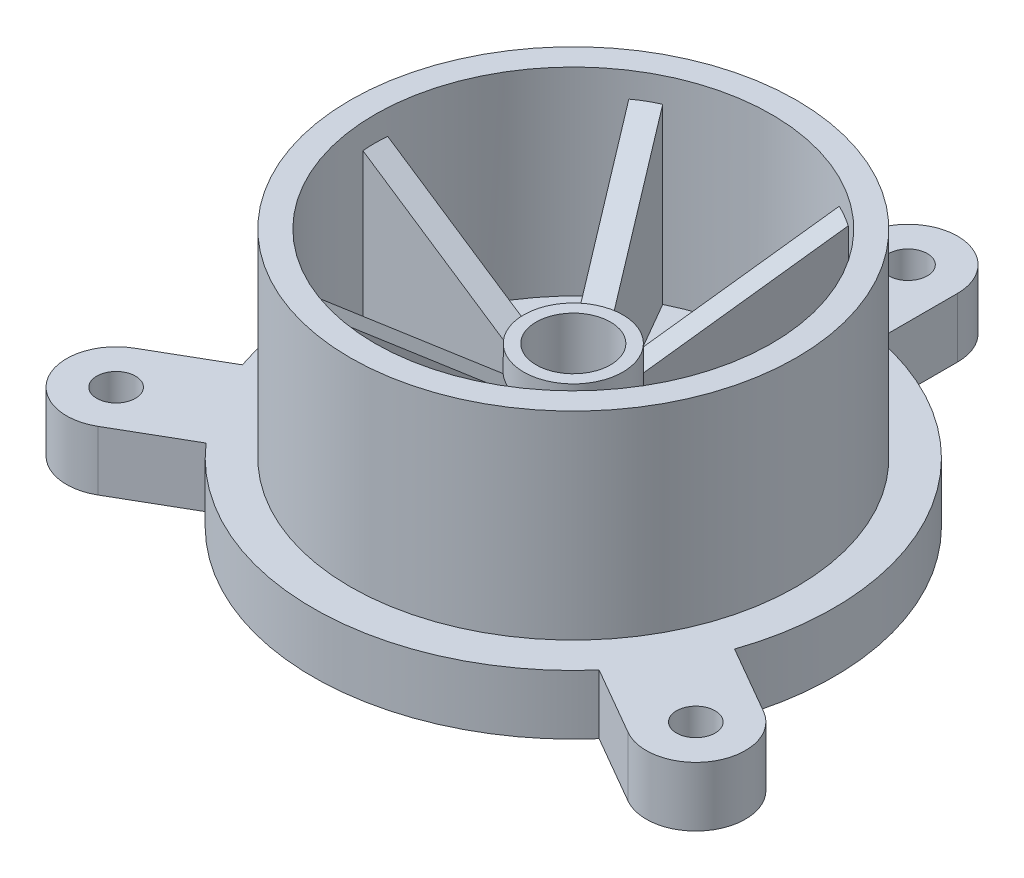
from build123d import *

# Parameters (mm, degrees)
SKETCH1_R           = 3.9
BOSS_EXTRUDE1_DEPTH = 12
SKETCH2_R           = 7.5
CUT_EXTRUDE1_DEPTH  = 12
BOSS_EXTRUDE2_START = 20
SKETCH4_R           = 10
SKETCH4_R_2         = 7.5
BOSS_EXTRUDE2_DEPTH = 20
SKETCH5_R           = 45
SKETCH5_R_2         = 40
BOSS_EXTRUDE3_DEPTH = 40
RIB1_REACH          = 117.744
SKETCH6_WALL_W      = 269.542633736
SKETCH6_WALL_H      = 5
CIRPATTERN1_COUNT   = 6


with BuildPart() as part:
    # Sketch1 → Boss-Extrude1 (new body)
    with BuildSketch(Plane(origin=(0, 0, 0), x_dir=(1, 0, 0), z_dir=(0, 1, 0))):
        with BuildLine():
            ThreePointArc((10, 67.5), (0, 77.5), (-10, 67.5))
            Line((-10, 67.5), (-10, 51.53882032))
            ThreePointArc((-10, 51.53882032), (-45.466333699, 26.25), (-49.633927678, -17.109156122))
            Line((-49.633927678, -17.109156122), (-63.456714755, -25.089745962))
            ThreePointArc((-63.456714755, -25.089745962), (-67.116968793, -38.75), (-53.456714755, -42.410254038))
            Line((-53.456714755, -42.410254038), (-39.633927678, -34.429664198))
            ThreePointArc((-39.633927678, -34.429664198), (0, -52.5), (39.633927678, -34.429664198))
            Line((39.633927678, -34.429664198), (53.456714755, -42.410254038))
            ThreePointArc((53.456714755, -42.410254038), (67.116968793, -38.75), (63.456714755, -25.089745962))
            Line((63.456714755, -25.089745962), (49.633927678, -17.109156122))
            ThreePointArc((49.633927678, -17.109156122), (45.466333699, 26.25), (10, 51.53882032))
            Line((10, 51.53882032), (10, 67.5))
        make_face()
        with Locations((-58.456714755, -33.75)):
            Circle(SKETCH1_R, mode=Mode.SUBTRACT)
        with Locations((58.456714755, -33.75)):
            Circle(SKETCH1_R, mode=Mode.SUBTRACT)
        with Locations((0, 67.5)):
            Circle(SKETCH1_R, mode=Mode.SUBTRACT)
    extrude(amount=BOSS_EXTRUDE1_DEPTH)

    # Sketch2 → Cut-Extrude1 (cut)
    with BuildSketch(Plane(origin=(0, 12, 0), x_dir=(1, 0, 0), z_dir=(0, 1, 0))):
        Circle(SKETCH2_R)
    extrude(amount=-CUT_EXTRUDE1_DEPTH, mode=Mode.SUBTRACT)

    # Sketch4 → Boss-Extrude2 (add)
    with BuildSketch(Plane(origin=(0, 12, 0), x_dir=(1, 0, 0), z_dir=(0, 1, 0)).offset(BOSS_EXTRUDE2_START)):
        Circle(SKETCH4_R)
        Circle(SKETCH4_R_2, mode=Mode.SUBTRACT)
    extrude(amount=-BOSS_EXTRUDE2_DEPTH)

    # Sketch5 → Boss-Extrude3 (add)
    with BuildSketch(Plane(origin=(0, 12, 0), x_dir=(1, 0, 0), z_dir=(0, 1, 0))):
        Circle(SKETCH5_R)
        Circle(SKETCH5_R_2, mode=Mode.SUBTRACT)
    extrude(amount=BOSS_EXTRUDE3_DEPTH)

    # Sketch6 wall → Rib1 (add, up to next)
    with BuildSketch(Plane(origin=(25, 37, 0), x_dir=(0.832050294338, 0.554700196225, 0), z_dir=(-0.554700196225, 0.832050294338, 0)), mode=Mode.PRIVATE) as rib1_sk1:
        Rectangle(SKETCH6_WALL_W, SKETCH6_WALL_H)
    rib1_tool1 = extrude(rib1_sk1.sketch, amount=-RIB1_REACH, mode=Mode.PRIVATE) - part.part
    rib1 = rib1_tool1.solids().sort_by_distance((25, 37, 0))[0]
    add(rib1)

    # CirPattern1: Rib1 ×6 about axis
    cirpattern1_axis = Axis((0, 0, 0), (0, 1, 0))
    for i in range(1, CIRPATTERN1_COUNT):
        add(rib1.rotate(cirpattern1_axis, i * 360 / CIRPATTERN1_COUNT))


solid = part.part
